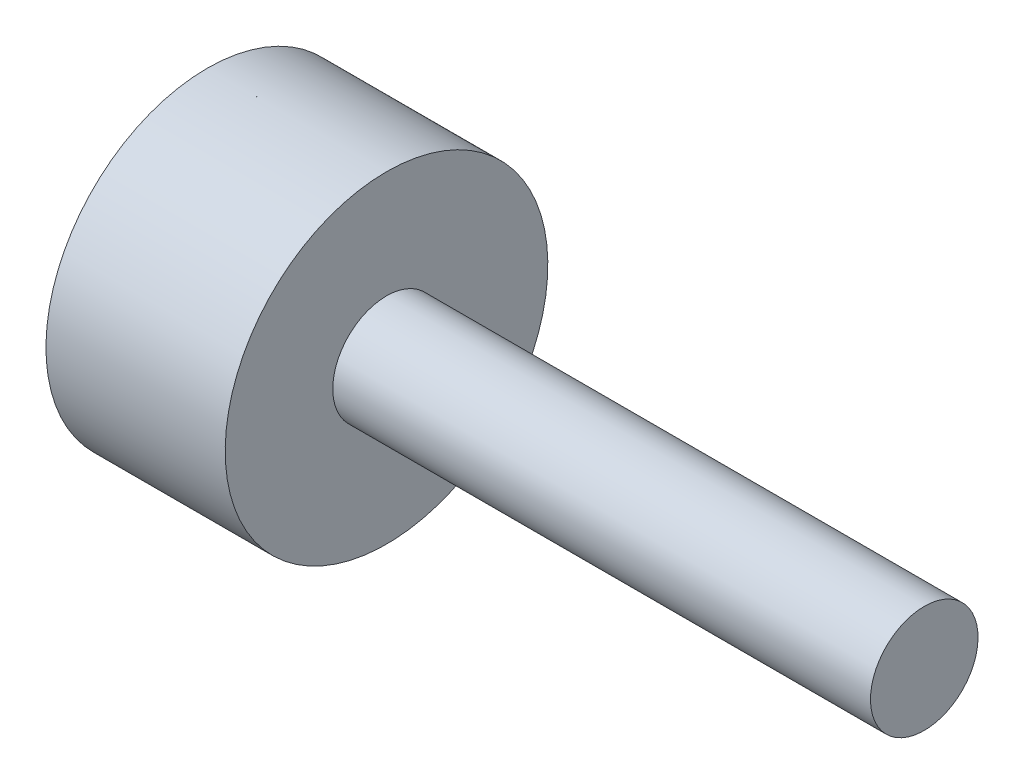
from build123d import *

# Parameters (mm, degrees)
REVOLVE1_ANGLE = 359.999695921


with BuildPart() as part:
    # Sketch1 → Revolve1 (revolve)
    with BuildSketch(Plane.XY):
        Polygon((0, 0), (0, 4.5), (5, 4.5), (5, 1.5), (20, 1.5), (20, 0), align=None)
    revolve(axis=Axis((0, 0, 0), (1, 0, 0)), revolution_arc=REVOLVE1_ANGLE)


solid = part.part
